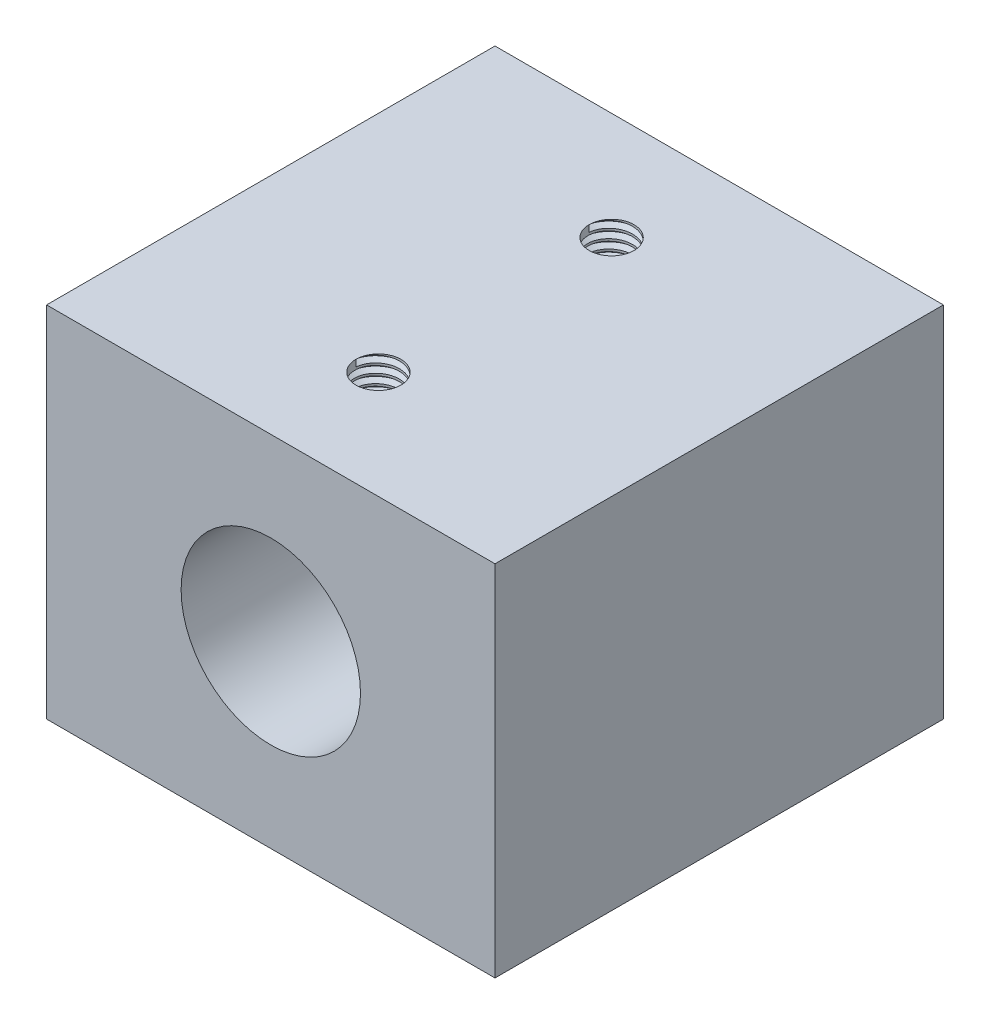
from build123d import *

# Parameters (mm, degrees)
SKETCH1_W             = 25
SKETCH1_H             = 20
SKETCH1_R             = 5
BOSS_EXTRUDE1_DEPTH   = 25
M3_TAPPED_HOLE1_D     = 2.5
M3_TAPPED_HOLE1_DEPTH = 8.5
M3_TAPPED_HOLE1_TIP   = 0.751075774
THREAD1_PITCH         = 0.5
THREAD2_PITCH         = 0.5


with BuildPart() as part:
    # Sketch1 → Boss-Extrude1 (new body)
    with BuildSketch(Plane.XY):
        Rectangle(SKETCH1_W, SKETCH1_H)
        Circle(SKETCH1_R, mode=Mode.SUBTRACT)
    extrude(amount=-BOSS_EXTRUDE1_DEPTH)

    # M3 Tapped Hole1
    with Locations(Plane(origin=(0, 10, 0), x_dir=(1, 0, 0), z_dir=(0, 1, 0))):
        with Locations((0, 6), (0, 19)):
            Hole(M3_TAPPED_HOLE1_D / 2, depth=M3_TAPPED_HOLE1_DEPTH)
            with Locations((0, 0, -(M3_TAPPED_HOLE1_DEPTH + M3_TAPPED_HOLE1_TIP / 2))):  # 118° drill point
                Cone(0, M3_TAPPED_HOLE1_D / 2, M3_TAPPED_HOLE1_TIP, mode=Mode.SUBTRACT)

    # Thread1: the profile of Thread Profile1 profile screwed along a right-hand helix of 20 turns, 6 arcs to a turn; built about Z, then put on its axis
    thread1_z = Axis((0, 0, 0), (0, 0, 1))
    thread1_corners = [(1.2497, 0, -0.000173205), (1.520632937, 0, 0.156249999), (1.520632937, 0, 0.218749999), (1.2497, 0, 0.375173204)]
    with BuildLine(mode=Mode.PRIVATE) as thread1_profile:
        Line(thread1_corners[0], thread1_corners[1])
        Line(thread1_corners[1], thread1_corners[2])
        Line(thread1_corners[2], thread1_corners[3])
        Line(thread1_corners[3], thread1_corners[0])
    thread1_cap = Face(thread1_profile.wire())
    thread1_turn_angles = [0, 30, 60, 90, 120, 150, 180, 210, 240, 270, 300, 330, 360]
    thread1_turn_weights = [1, 0.8660254037844387, 1, 0.8660254037844387, 1, 0.8660254037844387, 1, 0.8660254037844387, 1, 0.8660254037844387, 1, 0.8660254037844387, 1]
    thread1_turn_rails = [Edge.make_bspline([Vector(p[0], p[1], 0).rotate(thread1_z, thread1_turn_angles[k]) / thread1_turn_weights[k] + Vector(0, 0, p[2] + THREAD1_PITCH * thread1_turn_angles[k] / 360) for k in range(13)], [0, 0, 0, 1, 1, 2, 2, 3, 3, 4, 4, 5, 5, 6, 6, 6], 2, thread1_turn_weights) for p in thread1_corners]
    thread1_turn_sides = [Face.make_surface_from_curves(thread1_turn_rails[p[0]], thread1_turn_rails[p[1]]) for p in [(0, 1), (1, 2), (2, 3), (3, 0)]]
    thread1 = Plane(origin=(0, 10, -19), x_dir=(-1, 0, 0), z_dir=(0, -1, 0)) * Solid(Shell([*[p.moved(Location((0, 0, THREAD1_PITCH * i))) for i in range(20) for p in thread1_turn_sides], thread1_cap, thread1_cap.rotate(thread1_z, 7200).moved(Location((0, 0, THREAD1_PITCH * 7200 / 360)))]))
    add(thread1, mode=Mode.SUBTRACT)

    # Thread2: the profile of Thread Profile2 profile screwed along a right-hand helix of 20 turns, 6 arcs to a turn; built about Z, then put on its axis
    thread2_z = Axis((0, 0, 0), (0, 0, 1))
    thread2_corners = [(1.2497, 0, -0.000173205), (1.520632937, 0, 0.156249999), (1.520632937, 0, 0.218749999), (1.2497, 0, 0.375173204)]
    with BuildLine(mode=Mode.PRIVATE) as thread2_profile:
        Line(thread2_corners[0], thread2_corners[1])
        Line(thread2_corners[1], thread2_corners[2])
        Line(thread2_corners[2], thread2_corners[3])
        Line(thread2_corners[3], thread2_corners[0])
    thread2_cap = Face(thread2_profile.wire())
    thread2_turn_angles = [0, 30, 60, 90, 120, 150, 180, 210, 240, 270, 300, 330, 360]
    thread2_turn_weights = [1, 0.8660254037844387, 1, 0.8660254037844387, 1, 0.8660254037844387, 1, 0.8660254037844387, 1, 0.8660254037844387, 1, 0.8660254037844387, 1]
    thread2_turn_rails = [Edge.make_bspline([Vector(p[0], p[1], 0).rotate(thread2_z, thread2_turn_angles[k]) / thread2_turn_weights[k] + Vector(0, 0, p[2] + THREAD2_PITCH * thread2_turn_angles[k] / 360) for k in range(13)], [0, 0, 0, 1, 1, 2, 2, 3, 3, 4, 4, 5, 5, 6, 6, 6], 2, thread2_turn_weights) for p in thread2_corners]
    thread2_turn_sides = [Face.make_surface_from_curves(thread2_turn_rails[p[0]], thread2_turn_rails[p[1]]) for p in [(0, 1), (1, 2), (2, 3), (3, 0)]]
    thread2 = Plane(origin=(0, 10, -6), x_dir=(-1, 0, 0), z_dir=(0, -1, 0)) * Solid(Shell([*[p.moved(Location((0, 0, THREAD2_PITCH * i))) for i in range(20) for p in thread2_turn_sides], thread2_cap, thread2_cap.rotate(thread2_z, 7200).moved(Location((0, 0, THREAD2_PITCH * 7200 / 360)))]))
    add(thread2, mode=Mode.SUBTRACT)


solid = part.part
